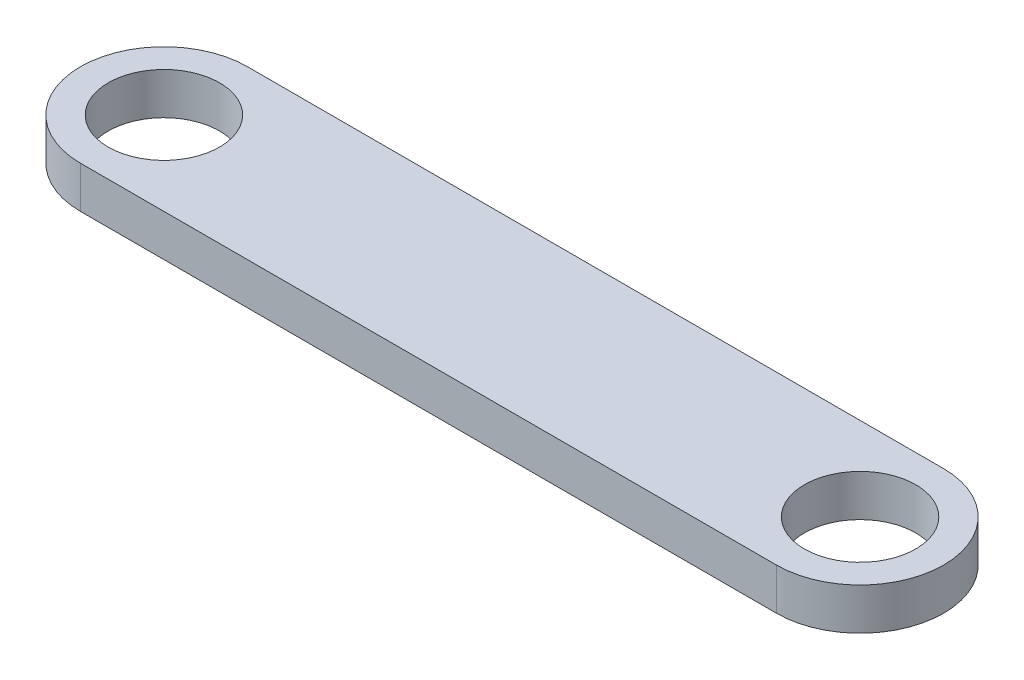
from build123d import *

# Parameters (mm, degrees)
SKETCH1_R           = 4
BOSS_EXTRUDE1_DEPTH = 3


with BuildPart() as part:
    # Sketch1 → Boss-Extrude1 (new body)
    with BuildSketch(Plane(origin=(0, 0, 0), x_dir=(1, 0, 0), z_dir=(0, 1, 0))):
        with BuildLine():
            Line((-40.12463695, 6.12463695), (9.87536305, 6.12463695))
            ThreePointArc((9.87536305, 6.12463695), (15.87536305, 0.12463695), (9.87536305, -5.87536305))
            Line((9.87536305, -5.87536305), (-40.12463695, -5.87536305))
            ThreePointArc((-40.12463695, -5.87536305), (-46.12463695, 0.12463695), (-40.12463695, 6.12463695))
        make_face()
        with Locations((-40.12463695, 0.12463695)):
            Circle(SKETCH1_R, mode=Mode.SUBTRACT)
        with Locations((9.87536305, 0.12463695)):
            Circle(SKETCH1_R, mode=Mode.SUBTRACT)
    extrude(amount=BOSS_EXTRUDE1_DEPTH)


solid = part.part
